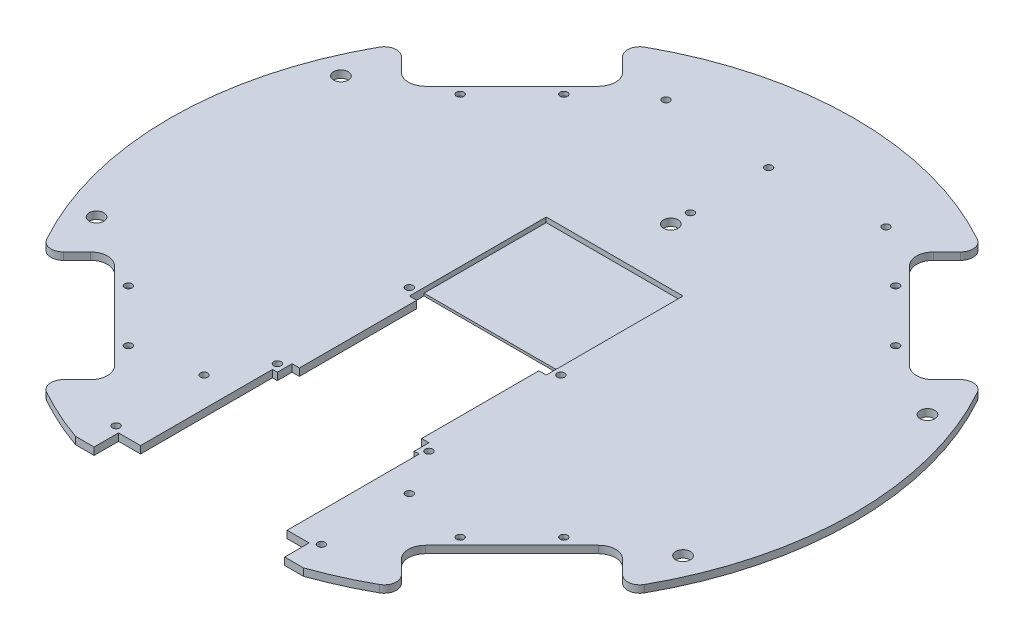
from build123d import *

# Parameters (mm, degrees)
SKETCH1_R                = 140
BOSS_EXTRUDE1_DEPTH      = 3
CUT_EXTRUDE4_REACH       = 200.013
CUT_EXTRUDE6_REACH       = 200.013
SKETCH9_R                = 1.5
FILLET1_R                = 5
CIRPATTERN1_COUNT        = 4
FILLET1_OF_CIRPATTERN1_R = 5
CUT_EXTRUDE1_REACH       = 200.013
FILLET3_R                = 1.5
CUT_EXTRUDE7_REACH       = 200.013
SKETCH10_R               = 1.5
CUT_EXTRUDE9_REACH       = 200.013
SKETCH13_R               = 1.5
CUT_EXTRUDE12_REACH      = 200.013
SKETCH16_R               = 1.5
SKETCH16_R_2             = 3
CUT_EXTRUDE13_REACH      = 200.013
SKETCH17_R               = 3
SKETCH18_W               = 56
SKETCH18_H               = 50
CUT_EXTRUDE14_DEPTH      = 2


with BuildPart() as part:
    # Sketch1 → Boss-Extrude1 (new body)
    with BuildSketch(Plane(origin=(0, 0, 0), x_dir=(1, 0, 0), z_dir=(0, 1, 0))):
        Circle(SKETCH1_R)
    extrude(amount=BOSS_EXTRUDE1_DEPTH)

    # Sketch7 → Cut-Extrude4 (cut, up to next)
    with BuildSketch(Plane(origin=(0, 3, 0), x_dir=(1, 0, 0), z_dir=(0, 1, 0)), mode=Mode.PRIVATE) as cut_extrude4_sk1:
        with BuildLine():
            Line((-99.030304705, -63.604254968), (-63.604254968, -99.030304705))
            ThreePointArc((-63.604254968, -99.030304705), (-61.568647097, -103.944696834), (-63.604254968, -108.859088964))
            Line((-63.604254968, -108.859088964), (-76.367532368, -121.622366364))
            Line((-76.367532368, -121.622366364), (-121.622366364, -76.367532368))
            Line((-121.622366364, -76.367532368), (-108.859088964, -63.604254968))
            ThreePointArc((-108.859088964, -63.604254968), (-103.944696834, -61.568647097), (-99.030304705, -63.604254968))
        make_face()
    cut_extrude4_tool1 = extrude(cut_extrude4_sk1.sketch, amount=-CUT_EXTRUDE4_REACH, mode=Mode.PRIVATE) & part.part
    cut_extrude4 = cut_extrude4_tool1.solids().sort_by_distance((-90.257735, 3, 90.257735))[0]
    add(cut_extrude4, mode=Mode.SUBTRACT)

    # Sketch9 → Cut-Extrude6 (cut, up to next)
    with BuildSketch(Plane(origin=(0, 3, 0), x_dir=(1, 0, 0), z_dir=(0, 1, 0)), mode=Mode.PRIVATE) as cut_extrude6_sk1:
        with Locations((-89.09545443, -67.882250994)):
            Circle(SKETCH9_R)
    cut_extrude6_tool1 = extrude(cut_extrude6_sk1.sketch, amount=-CUT_EXTRUDE6_REACH, mode=Mode.PRIVATE) & part.part
    # Sketch9 → Cut-Extrude6 (cut, up to next)
    with BuildSketch(Plane(origin=(0, 3, 0), x_dir=(1, 0, 0), z_dir=(0, 1, 0)), mode=Mode.PRIVATE) as cut_extrude6_sk2:
        with Locations((-67.882250994, -89.09545443)):
            Circle(SKETCH9_R)
    cut_extrude6_tool2 = extrude(cut_extrude6_sk2.sketch, amount=-CUT_EXTRUDE6_REACH, mode=Mode.PRIVATE) & part.part
    cut_extrude6_1 = cut_extrude6_tool1.solids().sort_by_distance((-89.095454, 3, 67.882251))[0]
    add(cut_extrude6_1, mode=Mode.SUBTRACT)
    cut_extrude6_2 = cut_extrude6_tool2.solids().sort_by_distance((-67.882251, 3, 89.095454))[0]
    add(cut_extrude6_2, mode=Mode.SUBTRACT)
    cut_extrude6 = cut_extrude6_1 + cut_extrude6_2  # Cut-Extrude6 as one shape, for the pattern or mirror that repeats it

    # Fillet1
    fillet1_edges = [part.edges().sort_by_distance(p)[0] for p in [
        (-73.746853427, 1.5, 119.001687423),
        (-119.001687423, 1.5, 73.746853427),
    ]]
    fillet(fillet1_edges, radius=FILLET1_R)

    # CirPattern1: Cut-Extrude4, Cut-Extrude6 ×4 about axis
    cirpattern1_axis = Axis((0, 3, 0), (0, 1, 0))
    add([cut_extrude4.rotate(cirpattern1_axis, i * 360 / CIRPATTERN1_COUNT) for i in range(1, CIRPATTERN1_COUNT)], mode=Mode.SUBTRACT)
    add([cut_extrude6.rotate(cirpattern1_axis, i * 360 / CIRPATTERN1_COUNT) for i in range(1, CIRPATTERN1_COUNT)], mode=Mode.SUBTRACT)

    # Fillet1 of CirPattern1
    fillet1_of_cirpattern1_edges = [part.edges().sort_by_distance(p)[0] for p in [
        (119.001687423, 1.5, 73.746853427),
        (73.746853427, 1.5, 119.001687423),
        (73.746853427, 1.5, -119.001687423),
        (119.001687423, 1.5, -73.746853427),
        (-119.001687423, 1.5, -73.746853427),
        (-73.746853427, 1.5, -119.001687423),
    ]]
    fillet(fillet1_of_cirpattern1_edges, radius=FILLET1_OF_CIRPATTERN1_R)

    # Sketch2 → Cut-Extrude1 (cut, up to next)
    with BuildSketch(Plane(origin=(0, 3, 0), x_dir=(1, 0, 0), z_dir=(0, 1, 0)), mode=Mode.PRIVATE) as cut_extrude1_sk1:
        Polygon((-46.647615159, -132), (-39, -132), (-39, -122), (-30, -122), (-30, -68), (-28, -68), (-28, -62), (-25, -62), (-25, -14), (-28, -14), (-28, -8), (28, -8), (28, -14), (25, -14), (25, -62), (28, -62), (28, -68), (30, -68), (30, -122), (39, -122), (39, -132), (46.647615159, -132), (46.647615159, -140), (-46.647615159, -140), align=None)
    cut_extrude1_tool1 = extrude(cut_extrude1_sk1.sketch, amount=-CUT_EXTRUDE1_REACH, mode=Mode.PRIVATE) & part.part
    add(cut_extrude1_tool1.solids().sort_by_distance((0, 3, 79.748961))[0], mode=Mode.SUBTRACT)

    # Fillet3
    fillet3_edges = [part.edges().sort_by_distance(p)[0] for p in [
        (67.882250994, 0, 90.59545443),
        (89.09545443, 0, 69.382250994),
        (90.59545443, 0, -67.882250994),
        (69.382250994, 0, -89.09545443),
        (-67.882250994, 0, -90.59545443),
        (-89.09545443, 0, -69.382250994),
        (-69.382250994, 0, 89.09545443),
        (-90.59545443, 0, 67.882250994),
    ]]
    fillet(fillet3_edges, radius=FILLET3_R)

    # Sketch10 → Cut-Extrude7 (cut, up to next)
    with BuildSketch(Plane(origin=(0, 3, 0), x_dir=(1, 0, 0), z_dir=(0, 1, 0)), mode=Mode.PRIVATE) as cut_extrude7_sk1:
        with Locations((-31, -65)):
            Circle(SKETCH10_R)
    cut_extrude7_tool1 = extrude(cut_extrude7_sk1.sketch, amount=-CUT_EXTRUDE7_REACH, mode=Mode.PRIVATE) & part.part
    # Sketch10 → Cut-Extrude7 (cut, up to next)
    with BuildSketch(Plane(origin=(0, 3, 0), x_dir=(1, 0, 0), z_dir=(0, 1, 0)), mode=Mode.PRIVATE) as cut_extrude7_sk2:
        with Locations((31, -65)):
            Circle(SKETCH10_R)
    cut_extrude7_tool2 = extrude(cut_extrude7_sk2.sketch, amount=-CUT_EXTRUDE7_REACH, mode=Mode.PRIVATE) & part.part
    # Sketch10 → Cut-Extrude7 (cut, up to next)
    with BuildSketch(Plane(origin=(0, 3, 0), x_dir=(1, 0, 0), z_dir=(0, 1, 0)), mode=Mode.PRIVATE) as cut_extrude7_sk3:
        with Locations((-31, -11)):
            Circle(SKETCH10_R)
    cut_extrude7_tool3 = extrude(cut_extrude7_sk3.sketch, amount=-CUT_EXTRUDE7_REACH, mode=Mode.PRIVATE) & part.part
    # Sketch10 → Cut-Extrude7 (cut, up to next)
    with BuildSketch(Plane(origin=(0, 3, 0), x_dir=(1, 0, 0), z_dir=(0, 1, 0)), mode=Mode.PRIVATE) as cut_extrude7_sk4:
        with Locations((31, -11)):
            Circle(SKETCH10_R)
    cut_extrude7_tool4 = extrude(cut_extrude7_sk4.sketch, amount=-CUT_EXTRUDE7_REACH, mode=Mode.PRIVATE) & part.part
    add(cut_extrude7_tool1.solids().sort_by_distance((-31, 3, 65))[0], mode=Mode.SUBTRACT)
    add(cut_extrude7_tool2.solids().sort_by_distance((31, 3, 65))[0], mode=Mode.SUBTRACT)
    add(cut_extrude7_tool3.solids().sort_by_distance((-31, 3, 11))[0], mode=Mode.SUBTRACT)
    add(cut_extrude7_tool4.solids().sort_by_distance((31, 3, 11))[0], mode=Mode.SUBTRACT)

    # Sketch13 → Cut-Extrude9 (cut, up to next)
    with BuildSketch(Plane(origin=(0, 3, 0), x_dir=(1, 0, 0), z_dir=(0, 1, 0)), mode=Mode.PRIVATE) as cut_extrude9_sk1:
        with Locations((-42, -84)):
            Circle(SKETCH13_R)
    cut_extrude9_tool1 = extrude(cut_extrude9_sk1.sketch, amount=-CUT_EXTRUDE9_REACH, mode=Mode.PRIVATE) & part.part
    # Sketch13 → Cut-Extrude9 (cut, up to next)
    with BuildSketch(Plane(origin=(0, 3, 0), x_dir=(1, 0, 0), z_dir=(0, 1, 0)), mode=Mode.PRIVATE) as cut_extrude9_sk2:
        with Locations((-42, -120)):
            Circle(SKETCH13_R)
    cut_extrude9_tool2 = extrude(cut_extrude9_sk2.sketch, amount=-CUT_EXTRUDE9_REACH, mode=Mode.PRIVATE) & part.part
    # Sketch13 → Cut-Extrude9 (cut, up to next)
    with BuildSketch(Plane(origin=(0, 3, 0), x_dir=(1, 0, 0), z_dir=(0, 1, 0)), mode=Mode.PRIVATE) as cut_extrude9_sk3:
        with Locations((42, -120)):
            Circle(SKETCH13_R)
    cut_extrude9_tool3 = extrude(cut_extrude9_sk3.sketch, amount=-CUT_EXTRUDE9_REACH, mode=Mode.PRIVATE) & part.part
    # Sketch13 → Cut-Extrude9 (cut, up to next)
    with BuildSketch(Plane(origin=(0, 3, 0), x_dir=(1, 0, 0), z_dir=(0, 1, 0)), mode=Mode.PRIVATE) as cut_extrude9_sk4:
        with Locations((42, -84)):
            Circle(SKETCH13_R)
    cut_extrude9_tool4 = extrude(cut_extrude9_sk4.sketch, amount=-CUT_EXTRUDE9_REACH, mode=Mode.PRIVATE) & part.part
    add(cut_extrude9_tool1.solids().sort_by_distance((-42, 3, 84))[0], mode=Mode.SUBTRACT)
    add(cut_extrude9_tool2.solids().sort_by_distance((-42, 3, 120))[0], mode=Mode.SUBTRACT)
    add(cut_extrude9_tool3.solids().sort_by_distance((42, 3, 120))[0], mode=Mode.SUBTRACT)
    add(cut_extrude9_tool4.solids().sort_by_distance((42, 3, 84))[0], mode=Mode.SUBTRACT)

    # Sketch16 → Cut-Extrude12 (cut, up to next)
    with BuildSketch(Plane(origin=(0, 3, 0), x_dir=(1, 0, 0), z_dir=(0, 1, 0)), mode=Mode.PRIVATE) as cut_extrude12_sk1:
        with Locations((0, 73)):
            Circle(SKETCH16_R)
    cut_extrude12_tool1 = extrude(cut_extrude12_sk1.sketch, amount=-CUT_EXTRUDE12_REACH, mode=Mode.PRIVATE) & part.part
    # Sketch16 → Cut-Extrude12 (cut, up to next)
    with BuildSketch(Plane(origin=(0, 3, 0), x_dir=(1, 0, 0), z_dir=(0, 1, 0)), mode=Mode.PRIVATE) as cut_extrude12_sk2:
        with Locations((-45, 108)):
            Circle(SKETCH16_R)
    cut_extrude12_tool2 = extrude(cut_extrude12_sk2.sketch, amount=-CUT_EXTRUDE12_REACH, mode=Mode.PRIVATE) & part.part
    # Sketch16 → Cut-Extrude12 (cut, up to next)
    with BuildSketch(Plane(origin=(0, 3, 0), x_dir=(1, 0, 0), z_dir=(0, 1, 0)), mode=Mode.PRIVATE) as cut_extrude12_sk3:
        with Locations((45, 108)):
            Circle(SKETCH16_R)
    cut_extrude12_tool3 = extrude(cut_extrude12_sk3.sketch, amount=-CUT_EXTRUDE12_REACH, mode=Mode.PRIVATE) & part.part
    # Sketch16 → Cut-Extrude12 (cut, up to next)
    with BuildSketch(Plane(origin=(0, 3, 0), x_dir=(1, 0, 0), z_dir=(0, 1, 0)), mode=Mode.PRIVATE) as cut_extrude12_sk4:
        with Locations((0, 105)):
            Circle(SKETCH16_R)
    cut_extrude12_tool4 = extrude(cut_extrude12_sk4.sketch, amount=-CUT_EXTRUDE12_REACH, mode=Mode.PRIVATE) & part.part
    # Sketch16 → Cut-Extrude12 (cut, up to next)
    with BuildSketch(Plane(origin=(0, 3, 0), x_dir=(1, 0, 0), z_dir=(0, 1, 0)), mode=Mode.PRIVATE) as cut_extrude12_sk5:
        with Locations((0, 65)):
            Circle(SKETCH16_R_2)
    cut_extrude12_tool5 = extrude(cut_extrude12_sk5.sketch, amount=-CUT_EXTRUDE12_REACH, mode=Mode.PRIVATE) & part.part
    add(cut_extrude12_tool1.solids().sort_by_distance((0, 3, -73))[0], mode=Mode.SUBTRACT)
    add(cut_extrude12_tool2.solids().sort_by_distance((-45, 3, -108))[0], mode=Mode.SUBTRACT)
    add(cut_extrude12_tool3.solids().sort_by_distance((45, 3, -108))[0], mode=Mode.SUBTRACT)
    add(cut_extrude12_tool4.solids().sort_by_distance((0, 3, -105))[0], mode=Mode.SUBTRACT)
    add(cut_extrude12_tool5.solids().sort_by_distance((0, 3, -65))[0], mode=Mode.SUBTRACT)

    # Sketch17 → Cut-Extrude13 (cut, up to next)
    with BuildSketch(Plane(origin=(0, 3, 0), x_dir=(1, 0, 0), z_dir=(0, 1, 0)), mode=Mode.PRIVATE) as cut_extrude13_sk1:
        with Locations((-120, 50)):
            Circle(SKETCH17_R)
    cut_extrude13_tool1 = extrude(cut_extrude13_sk1.sketch, amount=-CUT_EXTRUDE13_REACH, mode=Mode.PRIVATE) & part.part
    # Sketch17 → Cut-Extrude13 (cut, up to next)
    with BuildSketch(Plane(origin=(0, 3, 0), x_dir=(1, 0, 0), z_dir=(0, 1, 0)), mode=Mode.PRIVATE) as cut_extrude13_sk2:
        with Locations((-120, -50)):
            Circle(SKETCH17_R)
    cut_extrude13_tool2 = extrude(cut_extrude13_sk2.sketch, amount=-CUT_EXTRUDE13_REACH, mode=Mode.PRIVATE) & part.part
    # Sketch17 → Cut-Extrude13 (cut, up to next)
    with BuildSketch(Plane(origin=(0, 3, 0), x_dir=(1, 0, 0), z_dir=(0, 1, 0)), mode=Mode.PRIVATE) as cut_extrude13_sk3:
        with Locations((120, 50)):
            Circle(SKETCH17_R)
    cut_extrude13_tool3 = extrude(cut_extrude13_sk3.sketch, amount=-CUT_EXTRUDE13_REACH, mode=Mode.PRIVATE) & part.part
    # Sketch17 → Cut-Extrude13 (cut, up to next)
    with BuildSketch(Plane(origin=(0, 3, 0), x_dir=(1, 0, 0), z_dir=(0, 1, 0)), mode=Mode.PRIVATE) as cut_extrude13_sk4:
        with Locations((120, -50)):
            Circle(SKETCH17_R)
    cut_extrude13_tool4 = extrude(cut_extrude13_sk4.sketch, amount=-CUT_EXTRUDE13_REACH, mode=Mode.PRIVATE) & part.part
    add(cut_extrude13_tool1.solids().sort_by_distance((-120, 3, -50))[0], mode=Mode.SUBTRACT)
    add(cut_extrude13_tool2.solids().sort_by_distance((-120, 3, 50))[0], mode=Mode.SUBTRACT)
    add(cut_extrude13_tool3.solids().sort_by_distance((120, 3, -50))[0], mode=Mode.SUBTRACT)
    add(cut_extrude13_tool4.solids().sort_by_distance((120, 3, 50))[0], mode=Mode.SUBTRACT)

    # Sketch18 → Cut-Extrude14 (cut)
    with BuildSketch(Plane(origin=(0, 3, 0), x_dir=(1, 0, 0), z_dir=(0, 1, 0))):
        with Locations((0, 17)):
            Rectangle(SKETCH18_W, SKETCH18_H)
    extrude(amount=-CUT_EXTRUDE14_DEPTH, mode=Mode.SUBTRACT)


solid = part.part
